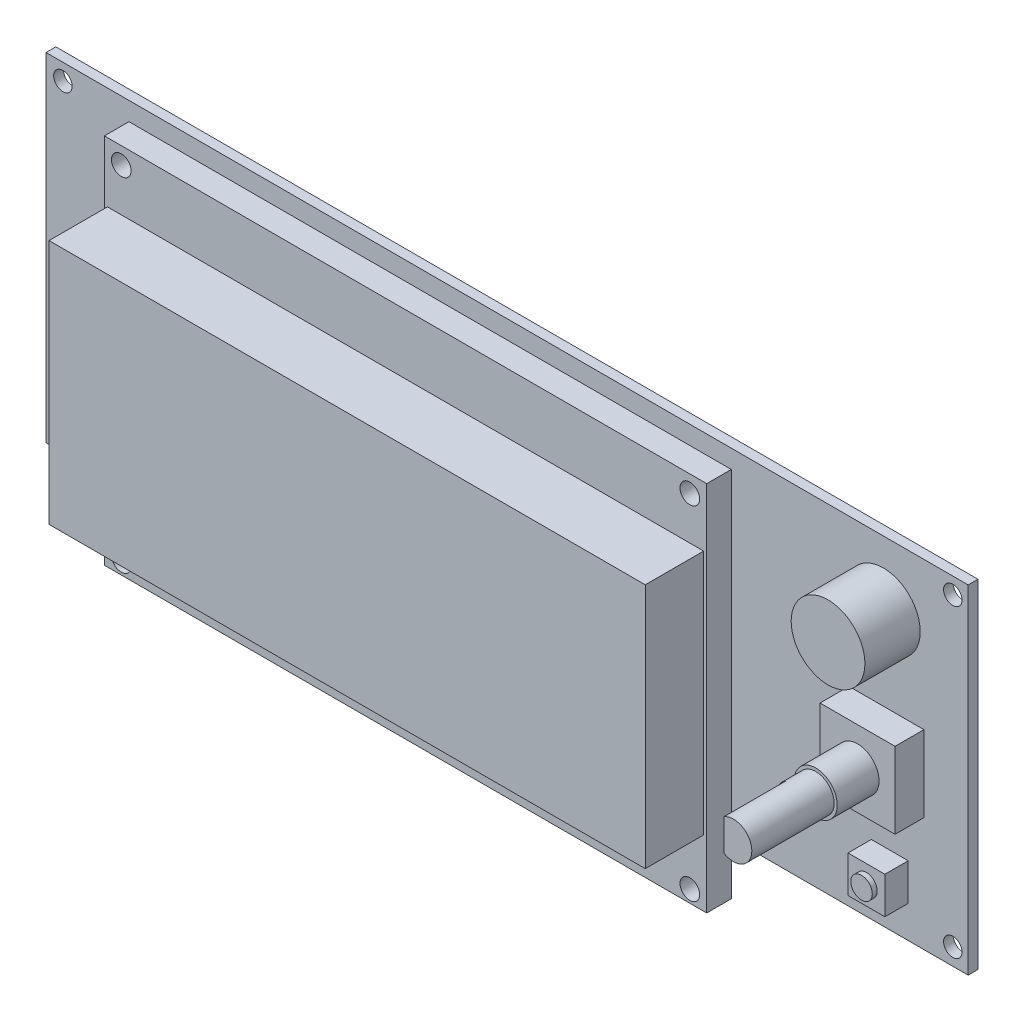
from build123d import *

# Parameters (mm, degrees)
SKETCH1_W                          = 150.0378
SKETCH1_H                          = 54.991
BOSS_EXTRUDE1_DEPTH                = 1.6002
SKETCH2_W                          = 98
SKETCH2_H                          = 60.5
BOSS_EXTRUDE2_DEPTH                = 4
SKETCH3_W                          = 97
SKETCH3_H                          = 40
BOSS_EXTRUDE3_DEPTH                = 9.5
SKETCH4_R                          = 6
BOSS_EXTRUDE4_DEPTH                = 9
SKETCH5_W                          = 12.2
SKETCH5_H                          = 12.4
BOSS_EXTRUDE5_DEPTH                = 4.7
SKETCH6_R                          = 3.5
BOSS_EXTRUDE6_DEPTH                = 6.8
SKETCH7_R                          = 3
BOSS_EXTRUDE7_DEPTH                = 13.4
SKETCH8_W                          = 1.5
SKETCH8_H                          = 5.196152422
CUT_EXTRUDE1_DEPTH                 = 10
SKETCH9_W                          = 6
SKETCH9_H                          = 6
BOSS_EXTRUDE8_DEPTH                = 3.8
SKETCH10_R                         = 1.75
BOSS_EXTRUDE9_DEPTH                = 0.8
SKETCH11_W                         = 27.3
SKETCH11_H                         = 26.4
BOSS_EXTRUDE10_DEPTH               = 2.6
SKETCH12_W                         = 20.2
SKETCH12_H                         = 23.2
BOSS_EXTRUDE11_DEPTH               = 9
F_3_0_3_DIAMETER_HOLE1_D           = 3
F_3_2_START                        = 1.6002
F_3_2_3_2_DIAMETER_HOLE1_OUTLINE_R = 1.6
F_3_2_3_2_DIAMETER_HOLE1_DEPTH     = 4


# Read off the part's stored shape, not the designer's step: Ø3.2 (3.2) Diameter Hole1
with BuildPart() as part:
    # Sketch1 → Boss-Extrude1 (new body)
    with BuildSketch(Plane.XY):
        Rectangle(SKETCH1_W, SKETCH1_H)
    extrude(amount=BOSS_EXTRUDE1_DEPTH)

    # Sketch2 → Boss-Extrude2 (add)
    with BuildSketch(Plane.XY.offset(1.6002)):
        with Locations((-12.5189, -5.7545)):
            Rectangle(SKETCH2_W, SKETCH2_H)
    extrude(amount=BOSS_EXTRUDE2_DEPTH)

    # Sketch3 → Boss-Extrude3 (add)
    with BuildSketch(Plane.XY.offset(5.6002)):
        with Locations((-12.5189, -5.2545)):
            Rectangle(SKETCH3_W, SKETCH3_H)
    extrude(amount=BOSS_EXTRUDE3_DEPTH)

    # Sketch4 → Boss-Extrude4 (add)
    with BuildSketch(Plane.XY.offset(1.6002)):
        with Locations(Location((61.2189, 16.9955, 0), (0, 0, 180))):
            Circle(SKETCH4_R)
    extrude(amount=BOSS_EXTRUDE4_DEPTH)

    # Sketch5 → Boss-Extrude5 (add)
    with BuildSketch(Plane.XY.offset(1.6002)):
        with Locations((61.7189, -2.6955)):
            Rectangle(SKETCH5_W, SKETCH5_H)
    extrude(amount=BOSS_EXTRUDE5_DEPTH)

    # Sketch6 → Boss-Extrude6 (add)
    with BuildSketch(Plane.XY.offset(6.3002)):
        with Locations((61.7189, -2.6955)):
            Circle(SKETCH6_R)
    extrude(amount=BOSS_EXTRUDE6_DEPTH)

    # Sketch7 → Boss-Extrude7 (add)
    with BuildSketch(Plane.XY.offset(13.1002)):
        with Locations((61.7189, -2.6955)):
            Circle(SKETCH7_R)
    extrude(amount=BOSS_EXTRUDE7_DEPTH)

    # Sketch8 → Cut-Extrude1 (cut)
    with BuildSketch(Plane.XY.offset(26.5002)):
        with Locations((59.4689, -2.6955)):
            Rectangle(SKETCH8_W, SKETCH8_H)
    extrude(amount=-CUT_EXTRUDE1_DEPTH, mode=Mode.SUBTRACT)

    # Sketch9 → Boss-Extrude8 (add)
    with BuildSketch(Plane.XY.offset(1.6002)):
        with Locations((62.2689, -19.2455)):
            Rectangle(SKETCH9_W, SKETCH9_H)
    extrude(amount=BOSS_EXTRUDE8_DEPTH)

    # Sketch10 → Boss-Extrude9 (add)
    with BuildSketch(Plane.XY.offset(5.4002)):
        with Locations((62.2689, -19.2455)):
            Circle(SKETCH10_R)
    extrude(amount=BOSS_EXTRUDE9_DEPTH)

    # Sketch11 → Boss-Extrude10 (add)
    with BuildSketch(Plane(origin=(0, 0, 0), x_dir=(-1, 0, 0), z_dir=(0, 0, -1))):
        with Locations((61.3689, -5.9955)):
            Rectangle(SKETCH11_W, SKETCH11_H)
    extrude(amount=BOSS_EXTRUDE10_DEPTH)

    # Sketch12 → Boss-Extrude11 (add)
    with BuildSketch(Plane(origin=(0, 0, 0), x_dir=(-1, 0, 0), z_dir=(0, 0, -1))):
        with Locations((19.2189, -9.0955)):
            Rectangle(SKETCH12_W, SKETCH12_H)
        with Locations((-3.7811, -9.0955)):
            Rectangle(SKETCH12_W, SKETCH12_H)
    extrude(amount=BOSS_EXTRUDE11_DEPTH)

    # Ø3.0 (3) Diameter Hole1 (through all)
    with Locations(Plane.XY.offset(1.6002)):
        with Locations((-72.2689, 24.8455), (-72.2689, -24.7455), (72.5189, -24.7455), (72.5189, 24.8455)):
            Hole(F_3_0_3_DIAMETER_HOLE1_D / 2)

    # Ø3.2 (3.2) Diameter Hole1 outline → Ø3.2 (3.2) Diameter Hole1 (cut)
    with BuildSketch(Plane.XY.offset(F_3_2_START)):
        with Locations((-58.7689, -34.0045)):
            Circle(F_3_2_3_2_DIAMETER_HOLE1_OUTLINE_R)
        with Locations((33.7311, -34.0045)):
            Circle(F_3_2_3_2_DIAMETER_HOLE1_OUTLINE_R)
        with Locations((33.7311, 21.7455)):
            Circle(F_3_2_3_2_DIAMETER_HOLE1_OUTLINE_R)
        with Locations((-58.7689, 21.7455)):
            Circle(F_3_2_3_2_DIAMETER_HOLE1_OUTLINE_R)
    extrude(amount=F_3_2_3_2_DIAMETER_HOLE1_DEPTH, mode=Mode.SUBTRACT)


solid = part.part
